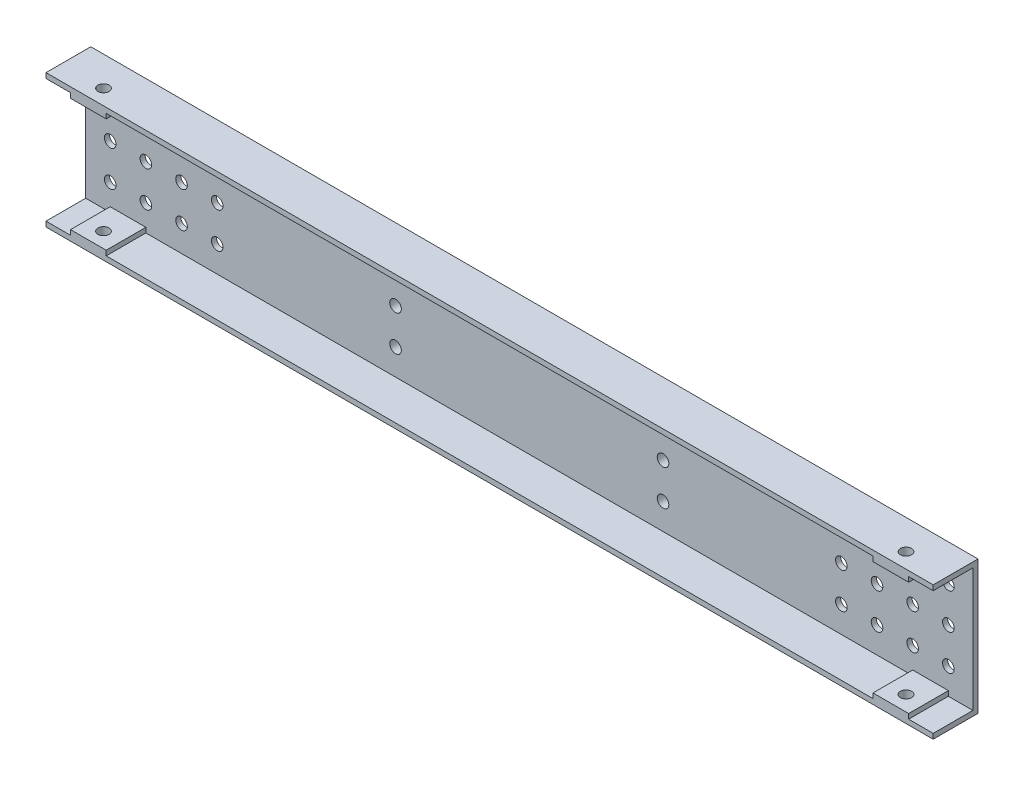
from build123d import *
from build123d.topology import SkipClean

# Parameters (mm, degrees)
SKETCH_1_W             = 1990
SKETCH_1_H             = 300
SKETCH_1_R             = 13
EXTRUDE_397_DEPTH      = 11.5
EXTRUDE_1_DEPTH        = 89
SKETCH_3_R             = 13
CUT_EXTRUDE_1_DEPTH    = 1045.090633039
PATTERN_LINEAR_1_COUNT = 3
PATTERN_LINEAR_1_PITCH = 80
EXTRUDE_START          = 16
SKETCH_7_W             = 70
SKETCH_7_H             = 230
SKETCH_7_R             = 13
EXTRUDE_2_DEPTH        = 16
SKETCH_8_R             = 12.5
CUT_EXTRUDE_2_DEPTH    = 1045.090633039


with BuildPart() as part:
    # 草图1 → Extrude 397 (new body)
    with BuildSketch(Plane.XY):
        with Locations((0, 150)):
            Rectangle(SKETCH_1_W, SKETCH_1_H)
        with Locations((300, 230)):
            Circle(SKETCH_1_R, mode=Mode.SUBTRACT)
        with Locations((300, 150)):
            Circle(SKETCH_1_R, mode=Mode.SUBTRACT)
        with Locations((300, 70)):
            Circle(SKETCH_1_R, mode=Mode.SUBTRACT)
        with Locations((-300, 70)):
            Circle(SKETCH_1_R, mode=Mode.SUBTRACT)
        with Locations((-300, 150)):
            Circle(SKETCH_1_R, mode=Mode.SUBTRACT)
        with Locations((-300, 230)):
            Circle(SKETCH_1_R, mode=Mode.SUBTRACT)
    extrude(amount=EXTRUDE_397_DEPTH)

    # 草图2 → 凸台-拉伸1 (add)
    with BuildSketch(Plane.XY.offset(11.5)):
        Polygon((-995, 300), (995, 300), (995, 288.5), (940, 288.5), (940, 277.5), (860, 277.5), (860, 288.5), (-860, 288.5), (-860, 277.5), (-940, 277.5), (-940, 288.5), (-995, 288.5), align=None)
        Polygon((-995, 0), (995, 0), (995, 11.5), (940, 11.5), (940, 22.5), (860, 22.5), (860, 11.5), (-860, 11.5), (-860, 22.5), (-940, 22.5), (-940, 11.5), (-995, 11.5), align=None)
    extrude(amount=EXTRUDE_1_DEPTH)

    # 草图3 → 切除-拉伸1 (cut, through all)
    with BuildSketch(Plane(origin=(0, 0, 0), x_dir=(-1, 0, 0), z_dir=(0, 0, -1))):
        with Locations((940, 70)):
            Circle(SKETCH_3_R)
        with Locations((860, 70)):
            Circle(SKETCH_3_R)
        with Locations((780, 70)):
            Circle(SKETCH_3_R)
        with Locations((700, 70)):
            Circle(SKETCH_3_R)
        with Locations((-940, 70)):
            Circle(SKETCH_3_R)
        with Locations((-860, 70)):
            Circle(SKETCH_3_R)
        with Locations((-780, 70)):
            Circle(SKETCH_3_R)
        with Locations((-700, 70)):
            Circle(SKETCH_3_R)
    cut_extrude_1 = extrude(amount=-CUT_EXTRUDE_1_DEPTH, mode=Mode.SUBTRACT)

    # 阵列(线性)1: 切除-拉伸1 ×3
    with Locations(*[(0, i * PATTERN_LINEAR_1_PITCH, 0) for i in range(1, PATTERN_LINEAR_1_COUNT)]):
        add(cut_extrude_1, mode=Mode.SUBTRACT)

    # 草图7 → 凸台-拉伸2 (add)
    # profile 1 of 2: a face of its own
    with SkipClean():  # the faces are left unmerged after this step: merging them gives an invalid solid
        with BuildSketch(Plane(origin=(0, 0, 0), x_dir=(-1, 0, 0), z_dir=(0, 0, -1)).offset(EXTRUDE_START)):
            with Locations((300, 150)):
                Rectangle(SKETCH_7_W, SKETCH_7_H)
            with Locations((300, 230)):
                Circle(SKETCH_7_R, mode=Mode.SUBTRACT)
            with Locations((300, 150)):
                Circle(SKETCH_7_R, mode=Mode.SUBTRACT)
            with Locations((300, 70)):
                Circle(SKETCH_7_R, mode=Mode.SUBTRACT)
        # profile 2 of 2: a face of its own
        with BuildSketch(Plane(origin=(0, 0, 0), x_dir=(-1, 0, 0), z_dir=(0, 0, -1)).offset(EXTRUDE_START)):
            with Locations((-300, 150)):
                Rectangle(SKETCH_7_W, SKETCH_7_H)
            with Locations((-300, 70)):
                Circle(SKETCH_7_R, mode=Mode.SUBTRACT)
            with Locations((-300, 150)):
                Circle(SKETCH_7_R, mode=Mode.SUBTRACT)
            with Locations((-300, 230)):
                Circle(SKETCH_7_R, mode=Mode.SUBTRACT)
        extrude(amount=-EXTRUDE_2_DEPTH)

    # 草图8 → 切除-拉伸2 (cut, through all)
    with SkipClean():  # the faces are left unmerged after this step: merging them gives an invalid solid
        with BuildSketch(Plane(origin=(0, 300, 0), x_dir=(-1, 0, 0), z_dir=(0, 1, 0))):
            with Locations((900, 66.5)):
                Circle(SKETCH_8_R)
            with Locations((-900, 66.5)):
                Circle(SKETCH_8_R)
        extrude(amount=-CUT_EXTRUDE_2_DEPTH, mode=Mode.SUBTRACT)


solid = part.part
